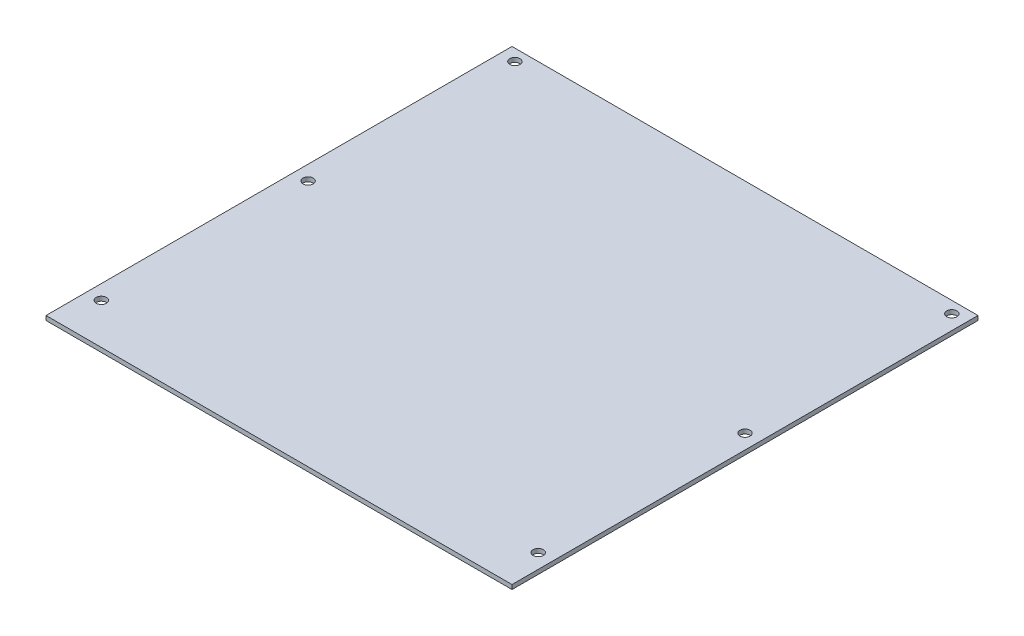
from build123d import *

# Parameters (mm, degrees)
CROQUIS1_W              = 160
CROQUIS1_H              = 160
CROQUIS1_R              = 1.75
SALIENTE_EXTRUIR1_DEPTH = 1.5


with BuildPart() as part:
    # Croquis1 → Saliente-Extruir1 (new body)
    with BuildSketch(Plane(origin=(0, 0, 0), x_dir=(1, 0, 0), z_dir=(0, 1, 0))):
        Rectangle(CROQUIS1_W, CROQUIS1_H)
        with Locations((-75, 76)):
            Circle(CROQUIS1_R, mode=Mode.SUBTRACT)
        with Locations((75, 76)):
            Circle(CROQUIS1_R, mode=Mode.SUBTRACT)
        with Locations((-75, 5)):
            Circle(CROQUIS1_R, mode=Mode.SUBTRACT)
        with Locations((-75, -66)):
            Circle(CROQUIS1_R, mode=Mode.SUBTRACT)
        with Locations((75, -66)):
            Circle(CROQUIS1_R, mode=Mode.SUBTRACT)
        with Locations((75, 5)):
            Circle(CROQUIS1_R, mode=Mode.SUBTRACT)
    extrude(amount=SALIENTE_EXTRUIR1_DEPTH)


solid = part.part
